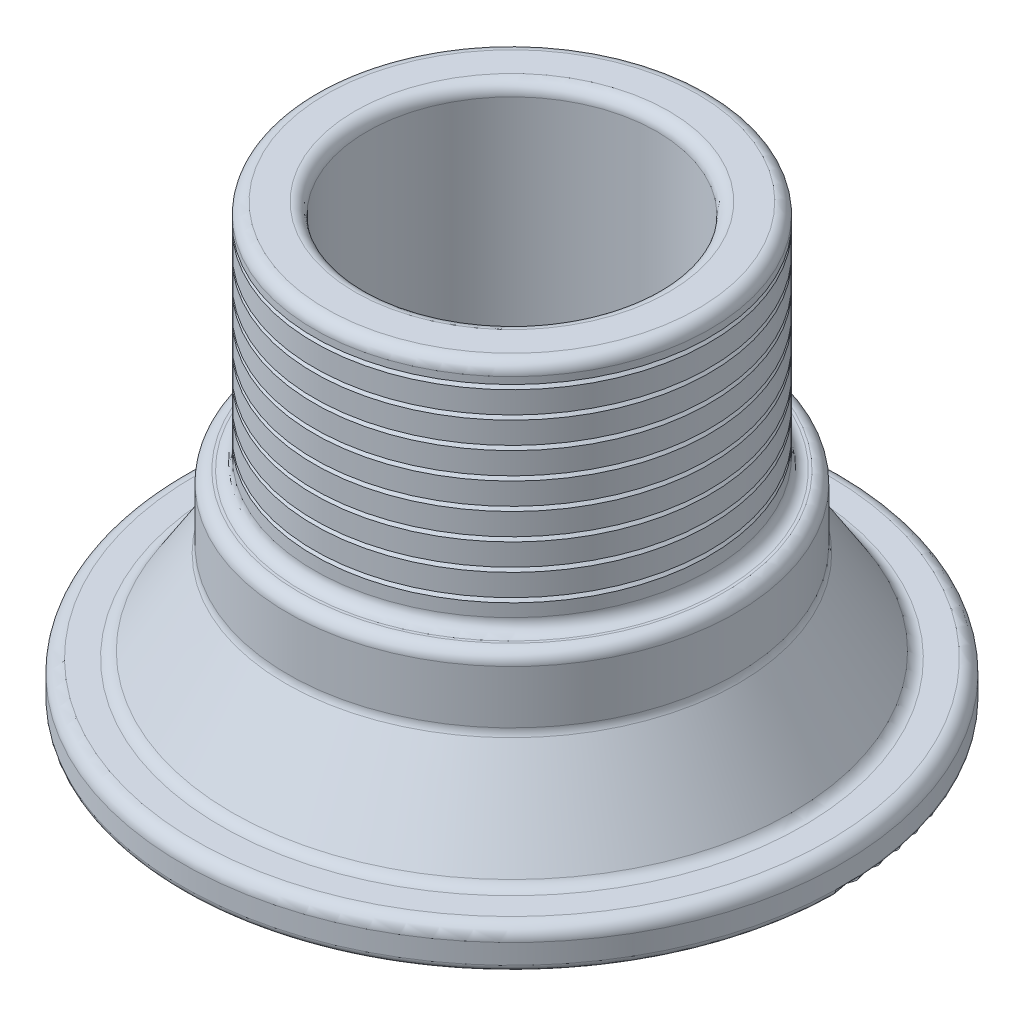
from build123d import *
from build123d.topology import SkipClean

# Parameters (mm, degrees)
THREAD1_PITCH = 1.75


with BuildPart() as part:
    # Sketch2 → Revolve1 (revolve)
    with BuildSketch(Plane.XY, mode=Mode.PRIVATE) as revolve1_sk:
        with BuildLine():
            Line((-14, 1), (-14, 3))
            Line((-14, 3), (-14, 13))
            Line((-14, 13), (-11, 13))
            Line((-11, 13), (-11, 32.1))
            ThreePointArc((-11, 32.1), (-11.263603897, 32.736396103), (-11.9, 33))
            Line((-11.9, 33), (-14.1, 33))
            ThreePointArc((-14.1, 33), (-14.736396103, 32.736396103), (-15, 32.1))
            Line((-15, 32.1), (-15, 31.582559721))
            Line((-15, 31.582559721), (-14.729977947, 31.582559721))
            Line((-14.729977947, 31.582559721), (-15, 31.242481487))
            Line((-15, 31.242481487), (-15, 29.582559721))
            Line((-15, 29.582559721), (-14.729977947, 29.582559721))
            Line((-14.729977947, 29.582559721), (-15, 29.242481487))
            Line((-15, 29.242481487), (-15, 27.582559721))
            Line((-15, 27.582559721), (-14.729977947, 27.582559721))
            Line((-14.729977947, 27.582559721), (-15, 27.242481487))
            Line((-15, 27.242481487), (-15, 25.582559721))
            Line((-15, 25.582559721), (-14.729977947, 25.582559721))
            Line((-14.729977947, 25.582559721), (-15, 25.242481487))
            Line((-15, 25.242481487), (-15, 23.582559721))
            Line((-15, 23.582559721), (-14.729977947, 23.582559721))
            Line((-14.729977947, 23.582559721), (-15, 23.242481487))
            Line((-15, 23.242481487), (-15, 21.582559721))
            Line((-15, 21.582559721), (-14.729977947, 21.582559721))
            Line((-14.729977947, 21.582559721), (-15, 21.242481487))
            Line((-15, 21.242481487), (-15, 19.582559721))
            Line((-15, 19.582559721), (-14.729977947, 19.582559721))
            Line((-14.729977947, 19.582559721), (-15, 19.242481487))
            Line((-15, 19.242481487), (-15, 17.582559721))
            Line((-15, 17.582559721), (-14.729977947, 17.582559721))
            Line((-14.729977947, 17.582559721), (-15, 17.242481487))
            Line((-15, 17.242481487), (-15, 16.269581154))
            ThreePointArc((-15, 16.269581154), (-15.263603897, 15.63318505), (-15.9, 15.369581154))
            Line((-15.9, 15.369581154), (-16.1, 15.369581154))
            ThreePointArc((-16.1, 15.369581154), (-16.736396103, 15.105977257), (-17, 14.469581154))
            Line((-17, 14.469581154), (-17, 10.440983006))
            ThreePointArc((-17, 10.440983006), (-17.039396037, 10.163062105), (-17.154480053, 9.90703917))
            Line((-17.154480053, 9.90703917), (-21.221945508, 3.466056164))
            ThreePointArc((-21.221945508, 3.466056164), (-21.584735632, 3.124230671), (-22.067465455, 3))
            Line((-22.067465455, 3), (-24, 3))
            ThreePointArc((-24, 3), (-24.707106781, 2.707106781), (-25, 2))
            Line((-25, 2), (-25, 0.5))
            ThreePointArc((-25, 0.5), (-24.853553391, 0.146446609), (-24.5, 0))
            Line((-24.5, 0), (-15, 0))
            Line((-15, 0), (-14, 1))
        make_face()
    revolve(revolve1_sk.sketch.rotate(Axis((0, 0, 0), (0, 1, 0)), 270), axis=Axis((0, 0, 0), (0, 1, 0)))

    # Thread1: the profile of Thread Profile1 profile screwed along a right-hand helix of 10.285714 turns, 10 arcs to a turn; built about Z, then put on its axis
    with SkipClean():  # the faces are left unmerged after this step: merging them gives an invalid solid
        thread1_z = Axis((0, 0, 0), (0, 0, 1))
        thread1_corners = [(14.0003, 0, -0.000173205), (14.0003, 0, 1.5314232), (13.052784719, 0, 0.984374998), (13.052784719, 0, 0.546874998)]
        with BuildLine(mode=Mode.PRIVATE) as thread1_profile:
            Line(thread1_corners[0], thread1_corners[1])
            Line(thread1_corners[1], thread1_corners[2])
            Line(thread1_corners[2], thread1_corners[3])
            Line(thread1_corners[3], thread1_corners[0])
        thread1_cap = Face(thread1_profile.wire())
        thread1_turn_angles = [0, 18, 36, 54, 72, 90, 108, 126, 144, 162, 180, 198, 216, 234, 252, 270, 288, 306, 324, 342, 360]
        thread1_turn_weights = [1, 0.9510565162951535, 1, 0.9510565162951535, 1, 0.9510565162951535, 1, 0.9510565162951535, 1, 0.9510565162951535, 1, 0.9510565162951535, 1, 0.9510565162951535, 1, 0.9510565162951535, 1, 0.9510565162951535, 1, 0.9510565162951535, 1]
        thread1_turn_rails = [Edge.make_bspline([Vector(p[0], p[1], 0).rotate(thread1_z, thread1_turn_angles[k]) / thread1_turn_weights[k] + Vector(0, 0, p[2] + THREAD1_PITCH * thread1_turn_angles[k] / 360) for k in range(21)], [0, 0, 0, 1, 1, 2, 2, 3, 3, 4, 4, 5, 5, 6, 6, 7, 7, 8, 8, 9, 9, 10, 10, 10], 2, thread1_turn_weights) for p in thread1_corners]
        thread1_turn_sides = [Face.make_surface_from_curves(thread1_turn_rails[p[0]], thread1_turn_rails[p[1]]) for p in [(0, 1), (1, 2), (2, 3), (3, 0)]]
        thread1_last_angles = [3600, 3618, 3636, 3654, 3672, 3687.428571429, 3702.857142857]
        thread1_last_weights = [1, 0.9510565162951535, 1, 0.9510565162951535, 1, 0.9639628606958538, 1]
        thread1_last_rails = [Edge.make_bspline([Vector(p[0], p[1], 0).rotate(thread1_z, thread1_last_angles[k]) / thread1_last_weights[k] + Vector(0, 0, p[2] + THREAD1_PITCH * thread1_last_angles[k] / 360) for k in range(7)], [0, 0, 0, 1, 1, 2, 2, 3, 3, 3], 2, thread1_last_weights) for p in thread1_corners]
        thread1_last_sides = [Face.make_surface_from_curves(thread1_last_rails[p[0]], thread1_last_rails[p[1]]) for p in [(0, 1), (1, 2), (2, 3), (3, 0)]]
        thread1 = Plane(origin=(0, 1, 0), x_dir=(1, 0, 0), z_dir=(0, 1, 0)) * Solid(Shell([*[p.moved(Location((0, 0, THREAD1_PITCH * i))) for i in range(10) for p in thread1_turn_sides], *thread1_last_sides, thread1_cap, thread1_cap.rotate(thread1_z, 3702.857142857).moved(Location((0, 0, THREAD1_PITCH * 3702.857142857 / 360)))]))
        add(thread1)


solid = part.part
